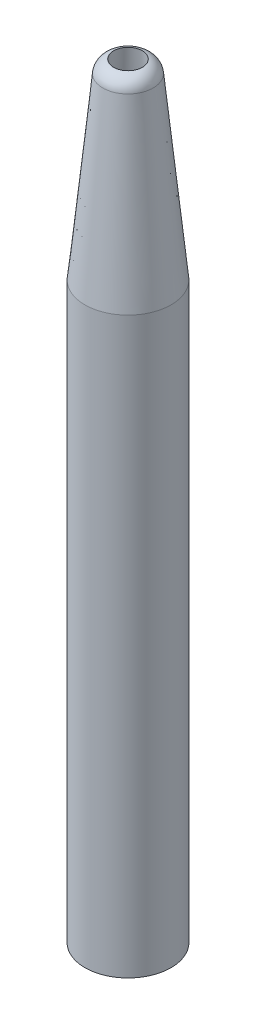
from build123d import *

# Parameters (mm, degrees)
SKETCH1_R           = 9
BOSS_EXTRUDE1_DEPTH = 120
SKETCH2_R           = 7
CUT_EXTRUDE1_DEPTH  = 120
FILLET5_R           = 3
FILLET6_R           = 6


with BuildPart() as part:
    # Sketch1 → Boss-Extrude1 (new body)
    with BuildSketch(Plane(origin=(0, 0, 0), x_dir=(1, 0, 0), z_dir=(0, 1, 0))):
        with Locations(Location((0, 0, 0), (0, 0, 270))):
            Circle(SKETCH1_R)
    extrude(amount=BOSS_EXTRUDE1_DEPTH)

    # Sketch2 → Cut-Extrude1 (cut)
    with BuildSketch(Plane.XZ):
        with Locations(Location((0, 0, 0), (0, 0, 270))):
            Circle(SKETCH2_R)
    extrude(amount=-CUT_EXTRUDE1_DEPTH, mode=Mode.SUBTRACT)

    # Sketch3 → Revolve1 (revolve)
    with BuildSketch(Plane.XY, mode=Mode.PRIVATE) as revolve1_sk:
        Polygon((9, 120), (4.9999999999999964, 160), (2.999999999999999, 160), (6.999999999999999, 120), align=None)
    revolve(revolve1_sk.sketch.rotate(Axis((0, 0, 0), (0, 1, 0)), 90), axis=Axis((0, 0, 0), (0, 1, 0)))

    # Fillet5
    # the kernel refuses this fillet: 3 mm, written as the material it takes off along each edge
    with BuildSketch(Plane(origin=(0, 160, 0), x_dir=(1.1e-16, 0, -1), z_dir=(1, 0, 1.1e-16))) as fillet5_piece_1:
        with BuildLine():
            CenterArc((2.276174333017459, -2.9113701935372944), FILLET5_R, 5.710593137499507, 70.32758962785506)
            Line((2.9999999999999947, -2.842e-14), (3.014476513339645, 0.0582274038707169))
            ThreePointArc((3.014476513339645, 0.0582274038707169), (3.9999999999999956, 0.06000000000000227), (4.9999999999999964, 0.06000000000000227))
            Line((4.9999999999999964, 0.06000000000000227), (5.0597022314125955, 0.00597022314124729))
            Line((5.0597022314125955, 0.00597022314124729), (5.320988135060026, -2.6068888133330574))
            Line((5.320988135060026, -2.6068888133330574), (5.261285903647427, -2.6128590364743047))
        make_face()
    revolve(axis=Axis((0, 160, 0), (0, 1, 0)), mode=Mode.SUBTRACT)

    # Fillet6
    # the kernel refuses this fillet: 6 mm, written as the material it takes off along each edge
    with BuildSketch(Plane(origin=(0, 0, 0), x_dir=(-1.8e-16, 0, -1), z_dir=(-1, 0, 1.8e-16))) as fillet6_piece_1:
        with BuildLine():
            CenterArc((13, -4.47213595499958), FILLET6_R, 131.81031489577862, 48.18968510422138)
            Line((7, -4.47213595499958), (6.88, -4.47213595499958))
            Line((6.88, -4.47213595499958), (6.88, 0))
            Line((6.88, 0), (7, 0.12))
            ThreePointArc((7, 0.12), (8, 0.12), (8.92, 0.08944271909999159))
            Line((8.92, 0.08944271909999159), (9, 0))
        make_face()
    revolve(axis=Axis((0, 0, 0), (0, -1, 0)), mode=Mode.SUBTRACT)


solid = part.part
